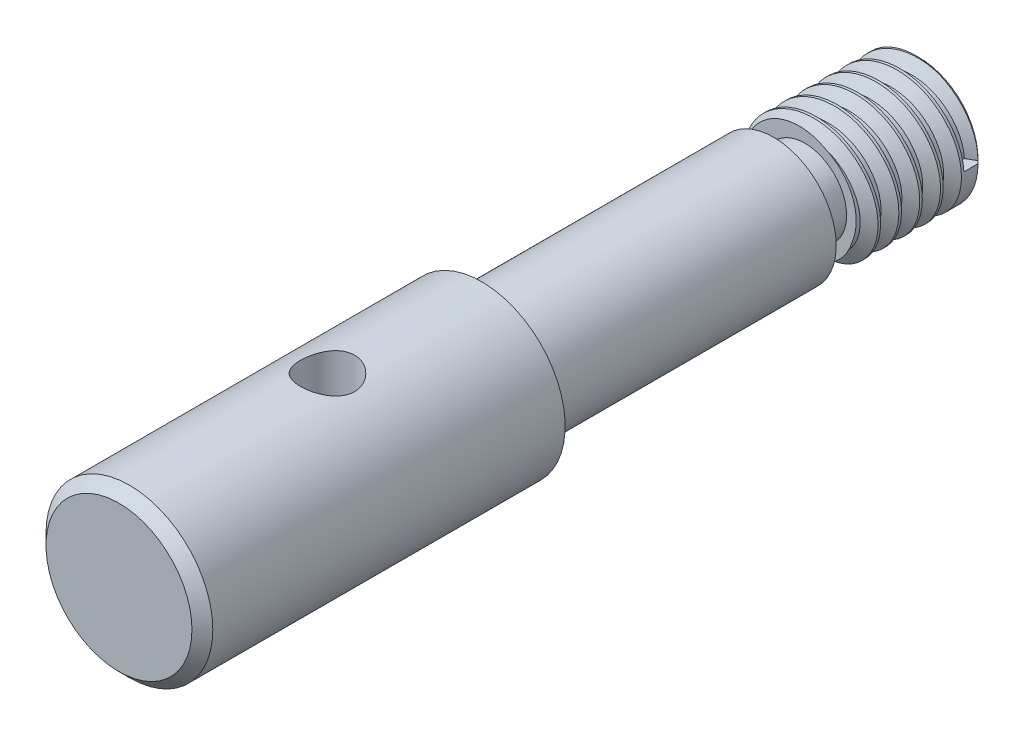
from build123d import *

# Parameters (mm, degrees)
CROQUIS1_R                 = 4
SALIENTE_EXTRUIR1_DEPTH    = 37.4
CROQUIS2_R                 = 1.3
CORTAR_EXTRUIR1_DEPTH      = 39.454648614
CROQUIS3_R                 = 4
CROQUIS3_R_2               = 3
CORTAR_EXTRUIR2_DEPTH      = 25
CROQUIS8_W                 = 20
CROQUIS8_H                 = 4
CORTAR_EXTRUIR3_DEPTH      = 39.454648742
CROQUIS9_R                 = 4
SALIENTE_EXTRUIR2_DEPTH    = 5
CHAFL_N1_SIZE              = 0.5
ROSCA2_PITCH               = 1
CORTAR_EXTRUIR4_DEPTH      = 0.5
CORTAR_EXTRUIR4_DEPTH_BACK = 1
CROQUIS13_R                = 6.495450524
CROQUIS13_R_2              = 2


with BuildPart() as part:
    # Croquis1 → Saliente-Extruir1 (new body)
    with BuildSketch(Plane.XY):
        Circle(CROQUIS1_R)
    extrude(amount=SALIENTE_EXTRUIR1_DEPTH)

    # Croquis2 → Cortar-Extruir1 (cut, through all)
    with BuildSketch(Plane(origin=(0, 4, 0), x_dir=(1, 0, 0), z_dir=(0, 1, 0))):
        with Locations(Location((0, -32.4, 0), (0, 0, 270))):
            Circle(CROQUIS2_R)
    extrude(amount=-CORTAR_EXTRUIR1_DEPTH, mode=Mode.SUBTRACT)

    # Croquis3 → Cortar-Extruir2 (cut)
    with BuildSketch(Plane(origin=(0, 0, 0), x_dir=(-1, 0, 0), z_dir=(0, 0, -1))):
        Circle(CROQUIS3_R)
        Circle(CROQUIS3_R_2, mode=Mode.SUBTRACT)
    extrude(amount=-CORTAR_EXTRUIR2_DEPTH, mode=Mode.SUBTRACT)

    # Croquis8 → Cortar-Extruir3 (cut, through all)
    with BuildSketch(Plane(origin=(0, 4, 0), x_dir=(1, 0, 0), z_dir=(0, 1, 0))):
        with Locations((0, -2)):
            Rectangle(CROQUIS8_W, CROQUIS8_H)
    extrude(amount=-CORTAR_EXTRUIR3_DEPTH, mode=Mode.SUBTRACT)

    # Croquis9 → Saliente-Extruir2 (add)
    with BuildSketch(Plane.XY.offset(37.4)):
        with Locations(Location((0, 0, 0), (0, 0, 180))):
            Circle(CROQUIS9_R)
    extrude(amount=SALIENTE_EXTRUIR2_DEPTH)

    # Chaflán1
    chafl_n1_edges = [part.edges().sort_by_distance(p)[0] for p in [
        (4, 0, 42.4),
    ]]
    chamfer(chafl_n1_edges, length=CHAFL_N1_SIZE)

    # Rosca2: arcs per turn and ends read off the stored shape
    # Rosca2: the profile of Perfil de rosca2 profile screwed along a right-hand helix through 6 turns, 8 arcs to a turn; built about Z, then put on its axis
    rosca2_z = Axis((0, 0, 0), (0, 0, 1))
    rosca2_corners = [(3.0003, 0, -0.000173205), (3.0003, 0, 0.875173202), (2.458734125, 0, 0.562499999), (2.458734125, 0, 0.312499999)]
    with BuildLine(mode=Mode.PRIVATE) as rosca2_profile:
        Line(rosca2_corners[0], rosca2_corners[1])
        Line(rosca2_corners[1], rosca2_corners[2])
        Line(rosca2_corners[2], rosca2_corners[3])
        Line(rosca2_corners[3], rosca2_corners[0])
    rosca2_cap = Face(rosca2_profile.wire())
    rosca2_turn_angles = [0, 22.5, 45, 67.5, 90, 112.5, 135, 157.5, 180, 202.5, 225, 247.5, 270, 292.5, 315, 337.5, 360]
    rosca2_turn_weights = [1, 0.9238795325112867, 1, 0.9238795325112867, 1, 0.9238795325112867, 1, 0.9238795325112867, 1, 0.9238795325112867, 1, 0.9238795325112867, 1, 0.9238795325112867, 1, 0.9238795325112867, 1]
    rosca2_turn_rails = [Edge.make_bspline([Vector(p[0], p[1], 0).rotate(rosca2_z, rosca2_turn_angles[k]) / rosca2_turn_weights[k] + Vector(0, 0, p[2] + ROSCA2_PITCH * rosca2_turn_angles[k] / 360) for k in range(17)], [0, 0, 0, 1, 1, 2, 2, 3, 3, 4, 4, 5, 5, 6, 6, 7, 7, 8, 8, 8], 2, rosca2_turn_weights) for p in rosca2_corners]
    rosca2_turn_sides = [Face.make_surface_from_curves(rosca2_turn_rails[p[0]], rosca2_turn_rails[p[1]]) for p in [(0, 1), (1, 2), (2, 3), (3, 0)]]
    rosca2 = Plane(origin=(0, 0, 4), x_dir=(1, 0, 0), z_dir=(0, 0, 1)) * Solid(Shell([*[p.moved(Location((0, 0, ROSCA2_PITCH * i))) for i in range(6) for p in rosca2_turn_sides], rosca2_cap, rosca2_cap.rotate(rosca2_z, 2160).moved(Location((0, 0, ROSCA2_PITCH * 2160 / 360)))]))
    add(rosca2, mode=Mode.SUBTRACT)

    # Chaflán2: read off the stored shape, not the designer's step
    # Chaflán2 outline → Chaflán2 (revolve, cut)
    with BuildSketch(Plane.XZ):
        Polygon((3, 4.2), (2.8, 4), (3, 4), align=None)
    revolve(axis=Axis((0, 0, 0), (0, 0, 1)), mode=Mode.SUBTRACT)

    # Croquis13 → Cortar-Extruir4 (cut, two sides: drawn at the far end of the back side and taken through both)
    with BuildSketch(Plane(origin=(0, 0, 10), x_dir=(-1, 0, 0), z_dir=(0, 0, -1)).offset(-CORTAR_EXTRUIR4_DEPTH_BACK)):
        Circle(CROQUIS13_R)
        Circle(CROQUIS13_R_2, mode=Mode.SUBTRACT)
    extrude(amount=CORTAR_EXTRUIR4_DEPTH + CORTAR_EXTRUIR4_DEPTH_BACK, mode=Mode.SUBTRACT)


solid = part.part
